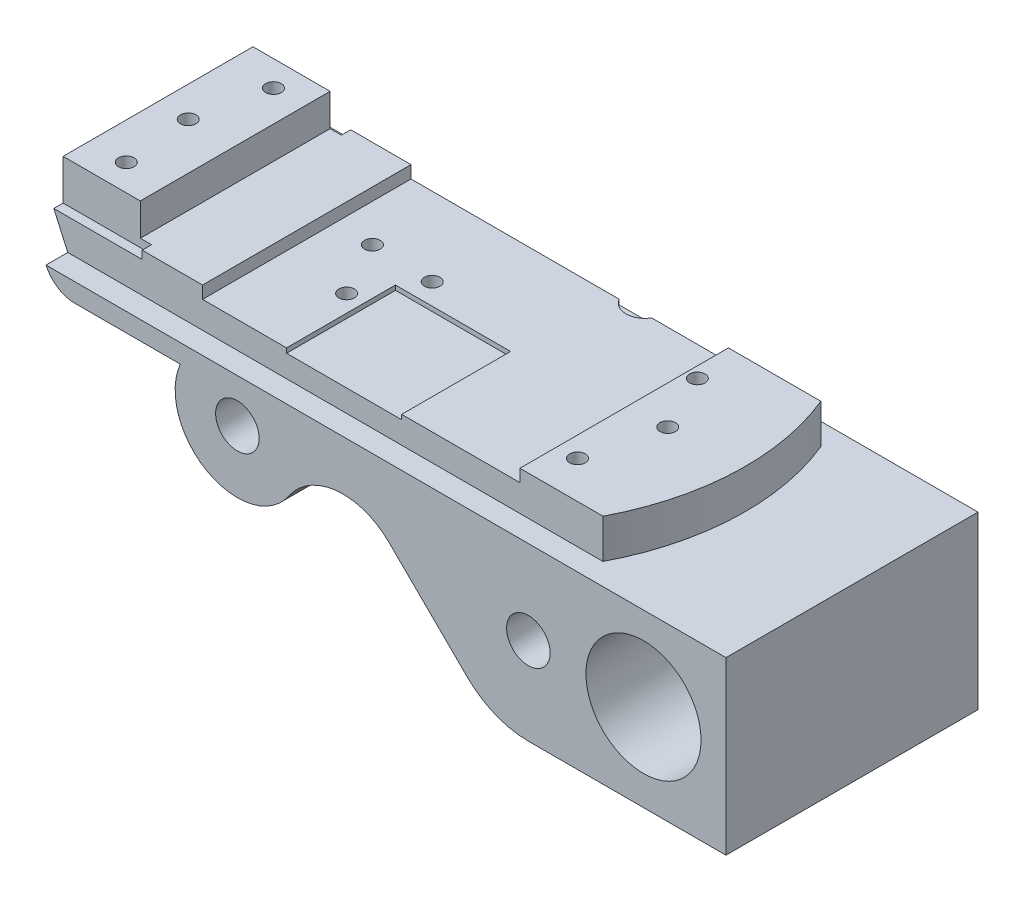
from build123d import *

# Parameters (mm, degrees)
SKETCH1_W              = 195
SKETCH1_H              = 67
BOSS_EXTRUDE1_DEPTH    = 23
CUT_EXTRUDE1_DEPTH     = 106.629067969
CUT_EXTRUDE2_DEPTH     = 121.516596367
CUT_EXTRUDE3_START     = -13
SKETCH4_W              = 3.612655346
SKETCH4_H              = 3
CUT_EXTRUDE3_DEPTH     = 13
SKETCH6_R              = 2.5
CUT_EXTRUDE4_DEPTH     = 106.629067969
SKETCH7_W              = 37
SKETCH7_H              = 35
CUT_EXTRUDE5_DEPTH     = 1.5
CUT_EXTRUDE6_DEPTH     = 18.5
BOSS_EXTRUDE2_DEPTH    = 55
CUT_EXTRUDE7_OUTLINE_R = 7
CUT_EXTRUDE7_DEPTH     = 81
CUT_EXTRUDE8_START     = -8
SKETCH11_R             = 26
CUT_EXTRUDE8_DEPTH     = 6
SKETCH12_R             = 18.5
CUT_EXTRUDE9_DEPTH     = 167.766303551
SKETCH13_R             = 12.5
CUT_EXTRUDE10_DEPTH    = 54
BOSS_EXTRUDE3_START    = -50
SKETCH14_R             = 18.5
SKETCH14_R_2           = 1.75
SKETCH14_R_3           = 7
BOSS_EXTRUDE3_DEPTH    = 7


# Read off the part's stored shape, not the designer's step: Cut-Extrude7
with BuildPart() as part:
    # Sketch1 → Boss-Extrude1 (new body)
    with BuildSketch(Plane(origin=(0, 0, 0), x_dir=(1, 0, 0), z_dir=(0, 1, 0))):
        Rectangle(SKETCH1_W, SKETCH1_H)
    extrude(amount=BOSS_EXTRUDE1_DEPTH)

    # Sketch2 → Cut-Extrude1 (cut, through all)
    with BuildSketch(Plane.XZ):
        with BuildLine():
            Line((97.5, -3.219751644), (97.5, 33.5))
            Line((97.5, 33.5), (88.5, 33.5))
            ThreePointArc((88.5, 33.5), (95.217186872, 15.683556008), (97.5, -3.219751644))
        make_face()
        with BuildLine():
            Line((97.5, -33.5), (97.5, -3.219751644))
            ThreePointArc((97.5, -3.219751644), (95.985558513, -18.65423771), (91.5, -33.5))
            Line((91.5, -33.5), (97.5, -33.5))
        make_face()
        with BuildLine():
            ThreePointArc((-88, -33.5), (-95.08607052, -15.861694529), (-97.5, 2.992884749))
            Line((-97.5, 2.992884749), (-97.5, -33.5))
            Line((-97.5, -33.5), (-88, -33.5))
        make_face()
        with BuildLine():
            ThreePointArc((-97.5, 2.992884749), (-95.856964648, 18.588830376), (-91, 33.5))
            Line((-91, 33.5), (-97.5, 33.5))
            Line((-97.5, 33.5), (-97.5, 2.992884749))
        make_face()
    extrude(amount=-CUT_EXTRUDE1_DEPTH, mode=Mode.SUBTRACT)

    # Sketch3 → Cut-Extrude2 (cut, through all)
    with BuildSketch(Plane(origin=(0, 0, 33.5), x_dir=(-1, 0, 0), z_dir=(0, 0, -1))):
        Polygon((63.2, 23), (63.2, 12.6), (40.2, 12.6), (40.2, 8.6), (-61.8, 8.6), (-61.8, 12.6), (-97.5, 12.6), (-97.5, 23), align=None)
    extrude(amount=CUT_EXTRUDE2_DEPTH, mode=Mode.SUBTRACT)

    # Sketch4 → Cut-Extrude3 (cut)
    with BuildSketch(Plane(origin=(0, 23, 0), x_dir=(1, 0, 0), z_dir=(0, 1, 0)).offset(CUT_EXTRUDE3_START)):
        with BuildLine():
            Line((-63.2, 30.5), (-63.2, 33.5))
            Line((-63.2, 33.5), (-88, 33.5))
            ThreePointArc((-88, 33.5), (-88.810680862, 32.008999469), (-89.587344654, 30.5))
            Line((-89.587344654, 30.5), (-63.2, 30.5))
        make_face()
        with Locations((-61.393672327, 32)):
            Rectangle(SKETCH4_W, SKETCH4_H)
        with BuildLine():
            Line((-63.2, -33.5), (-63.2, -30.5))
            Line((-63.2, -30.5), (-92.261692194, -30.5))
            ThreePointArc((-92.261692194, -30.5), (-91.647155152, -32.006859002), (-91, -33.5))
            Line((-91, -33.5), (-63.2, -33.5))
        make_face()
        with Locations((-61.393672327, -32)):
            Rectangle(SKETCH4_W, SKETCH4_H)
    extrude(amount=CUT_EXTRUDE3_DEPTH, mode=Mode.SUBTRACT)

    # Sketch6 → Cut-Extrude4 (cut, through all)
    with BuildSketch(Plane.XZ):
        with Locations(Location((-28.1, -9, 0), (0, 0, 270))):
            Circle(SKETCH6_R)
        with Locations(Location((-8.2, -8.3, 0), (0, 0, 270))):
            Circle(SKETCH6_R)
        with Locations(Location((-18.7, 8.7, 0), (0, 0, 270))):
            Circle(SKETCH6_R)
        with Locations(Location((-76.2, 22, 0), (0, 0, 270))):
            Circle(SKETCH6_R)
        with Locations(Location((-78.2, 0.1, 0), (0, 0, 270))):
            Circle(SKETCH6_R)
        with Locations(Location((-73.2, -22.3, 0), (0, 0, 270))):
            Circle(SKETCH6_R)
        with Locations(Location((65.3, -20, 0), (0, 0, 270))):
            Circle(SKETCH6_R)
        with Locations(Location((74.1, -1.7, 0), (0, 0, 270))):
            Circle(SKETCH6_R)
        with Locations(Location((68.3, 21.5, 0), (0, 0, 270))):
            Circle(SKETCH6_R)
    extrude(amount=-CUT_EXTRUDE4_DEPTH, mode=Mode.SUBTRACT)

    # Sketch7 → Cut-Extrude5 (cut)
    with BuildSketch(Plane(origin=(0, 8.6, 0), x_dir=(1, 0, 0), z_dir=(0, 1, 0))):
        with Locations((5.3, -16)):
            Rectangle(SKETCH7_W, SKETCH7_H)
    extrude(amount=-CUT_EXTRUDE5_DEPTH, mode=Mode.SUBTRACT)

    # Sketch8 → Cut-Extrude6 (cut)
    with BuildSketch(Plane(origin=(0, 23, 0), x_dir=(1, 0, 0), z_dir=(0, 1, 0))):
        with BuildLine():
            Line((37.096152423, 33.5), (31.9, 33.5))
            Line((31.9, 33.5), (31.9, 30.5))
            ThreePointArc((31.9, 30.5), (34.9, 31.303847577), (37.096152423, 33.5))
        make_face()
        with BuildLine():
            Line((31.9, 33.5), (26.703847577, 33.5))
            ThreePointArc((26.703847577, 33.5), (28.9, 31.303847577), (31.9, 30.5))
            Line((31.9, 30.5), (31.9, 33.5))
        make_face()
    extrude(amount=-CUT_EXTRUDE6_DEPTH, mode=Mode.SUBTRACT)

    # Sketch9 → Boss-Extrude2 (add)
    with BuildSketch(Plane.XZ):
        Polygon((-83.5, -27), (-83.5, -40.5), (135, -40.5), (135, 40.5), (-83.5, 40.5), (-83.5, 27), (81.5, 27), (81.5, 0), (81.5, -27), align=None)
    extrude(amount=BOSS_EXTRUDE2_DEPTH)

    # Cut-Extrude7 outline → Cut-Extrude7 (cut)
    with BuildSketch(Plane(origin=(-0.000736395, 0, 40.5), x_dir=(-1, 0, 0), z_dir=(0, 0, -1))):
        with BuildLine():
            Line((83.499263605, -55), (83.499263605, 0))
            ThreePointArc((83.499263605, 0), (79.744905458, -4.369344862), (74.219749945, -6))
            Line((74.219749945, -6), (40.329566384, -6))
            ThreePointArc((40.329566384, -6), (31.649853034, -31.517594688), (5.442617021, -25.219512195))
            ThreePointArc((5.442617021, -25.219512195), (-9.896457675, -16.099848766), (-26.712562231, -22.072628782))
            Line((-26.712562231, -22.072628782), (-51.806469277, -46.903161625))
            ThreePointArc((-51.806469277, -46.903161625), (-60.853871258, -52.896800241), (-71.500736395, -55))
            Line((-71.500736395, -55), (83.499263605, -55))
        make_face()
        Polygon((87.999263605, 10), (83.499263605, 0), (97.499263605, 0), (97.499263605, 23), (87.999263605, 23), align=None)
        with Locations((-71.500736395, -27)):
            Circle(CUT_EXTRUDE7_OUTLINE_R)
        with Locations((21.999263605, -14)):
            Circle(CUT_EXTRUDE7_OUTLINE_R)
    extrude(amount=CUT_EXTRUDE7_DEPTH, mode=Mode.SUBTRACT)

    # Sketch11 → Cut-Extrude8 (cut)
    with BuildSketch(Plane.XY.offset(CUT_EXTRUDE8_START)):
        with Locations((71.5, -27)):
            Circle(SKETCH11_R)
    extrude(amount=-CUT_EXTRUDE8_DEPTH, mode=Mode.SUBTRACT)

    # Sketch12 → Cut-Extrude9 (cut, through all)
    with BuildSketch(Plane.XY.offset(40.5)):
        with Locations((108.5, -27)):
            Circle(SKETCH12_R)
    extrude(amount=-CUT_EXTRUDE9_DEPTH, mode=Mode.SUBTRACT)

    # Sketch13 → Cut-Extrude10 (cut)
    with BuildSketch(Plane.XY.offset(-27)):
        with Locations((71.5, -27)):
            Circle(SKETCH13_R)
    extrude(amount=CUT_EXTRUDE10_DEPTH, mode=Mode.SUBTRACT)

    # Sketch14 → Boss-Extrude3 (add)
    with BuildSketch(Plane(origin=(0, 0, -40.5), x_dir=(-1, 0, 0), z_dir=(0, 0, -1)).offset(BOSS_EXTRUDE3_START)):
        with Locations(Location((-108.5, -27, 0), (0, 0, 180))):
            Circle(SKETCH14_R)
        with Locations((-108.5, -11.5)):
            Circle(SKETCH14_R_2, mode=Mode.SUBTRACT)
        with Locations((-95.076606241, -19.25)):
            Circle(SKETCH14_R_2, mode=Mode.SUBTRACT)
        with Locations((-95.076606241, -34.75)):
            Circle(SKETCH14_R_2, mode=Mode.SUBTRACT)
        with Locations((-108.5, -42.5)):
            Circle(SKETCH14_R_2, mode=Mode.SUBTRACT)
        with Locations((-121.923393759, -34.75)):
            Circle(SKETCH14_R_2, mode=Mode.SUBTRACT)
        with Locations((-121.923393759, -19.25)):
            Circle(SKETCH14_R_2, mode=Mode.SUBTRACT)
        with Locations((-101.5, -27)):
            Circle(SKETCH14_R_3, mode=Mode.SUBTRACT)
    extrude(amount=BOSS_EXTRUDE3_DEPTH)


solid = part.part
